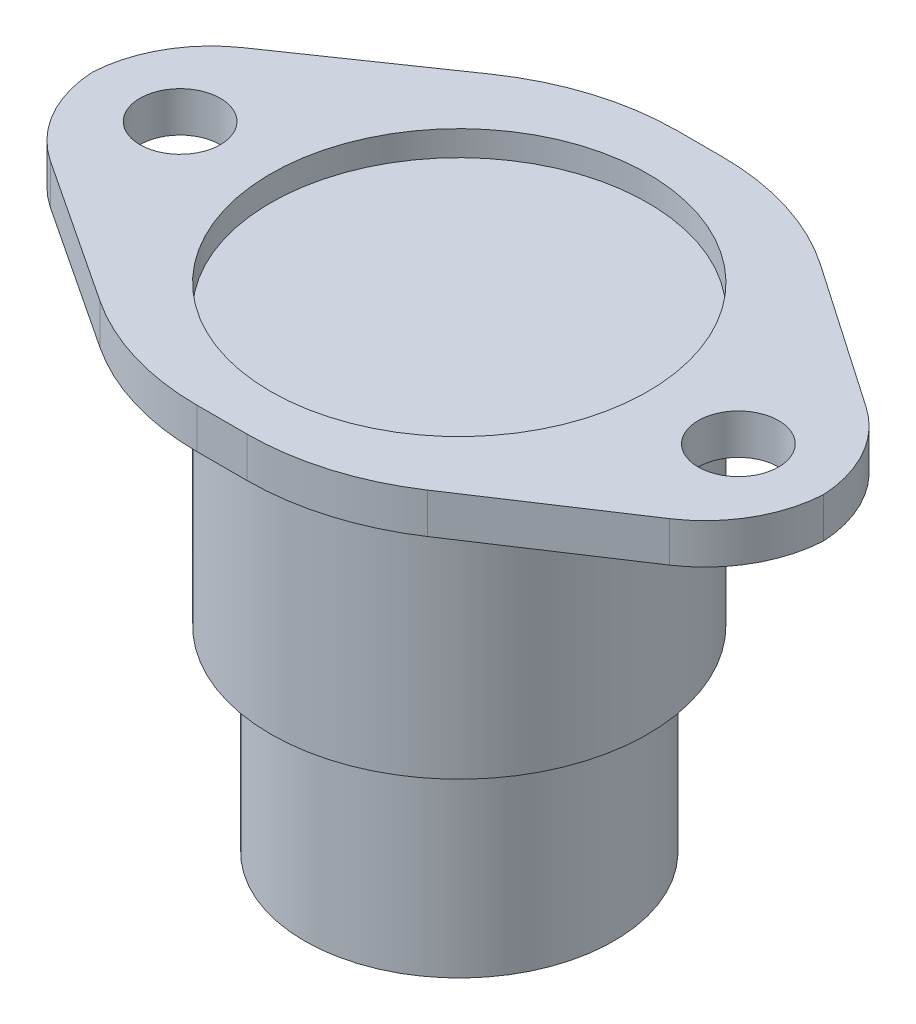
from build123d import *

# Parameters (mm, degrees)
SKETCH1_R           = 7.5
BOSS_EXTRUDE1_DEPTH = 10.2
SKETCH2_R           = 1.6
BOSS_EXTRUDE2_DEPTH = 1.6
SKETCH3_R           = 6.15
BOSS_EXTRUDE3_DEPTH = 7.8
CUT_EXTRUDE1_START  = -1
SKETCH4_R           = 7.5
CUT_EXTRUDE1_DEPTH  = 1
FILLET1_R           = 5
FILLET2_R           = 10


with BuildPart() as part:
    # Sketch1 → Boss-Extrude1 (new body)
    with BuildSketch(Plane(origin=(0, 0, 0), x_dir=(1, 0, 0), z_dir=(0, 1, 0))):
        with Locations(Location((0, 0, 0), (0, 0, 270))):
            Circle(SKETCH1_R)
    extrude(amount=BOSS_EXTRUDE1_DEPTH)

    # Sketch2 → Boss-Extrude2 (add)
    with BuildSketch(Plane(origin=(0, 10.2, 0), x_dir=(1, 0, 0), z_dir=(0, 1, 0))):
        Polygon((-14.55, 2.306992561), (-14.55, -2.466095496), (-4, -9.43480406), (4, -9.43480406), (14.55, -2.466095496), (14.55, 2.306992561), (4, 9.56519594), (-4, 9.56519594), align=None)
        with Locations(Location((-11.1, 0, 0), (0, 0, 270))):
            Circle(SKETCH2_R, mode=Mode.SUBTRACT)
        with Locations(Location((11.1, 0, 0), (0, 0, 270))):
            Circle(SKETCH2_R, mode=Mode.SUBTRACT)
    extrude(amount=BOSS_EXTRUDE2_DEPTH)

    # Sketch3 → Boss-Extrude3 (add)
    with BuildSketch(Plane.XZ):
        with Locations(Location((0, 0, 0), (0, 0, 90))):
            Circle(SKETCH3_R)
    extrude(amount=BOSS_EXTRUDE3_DEPTH)

    # Sketch4 → Cut-Extrude1 (cut)
    with BuildSketch(Plane(origin=(0, 11.8, 0), x_dir=(1, 0, 0), z_dir=(0, 1, 0)).offset(CUT_EXTRUDE1_START)):
        with Locations(Location((0, 0, 0), (0, 0, 270))):
            Circle(SKETCH4_R)
    extrude(amount=CUT_EXTRUDE1_DEPTH, mode=Mode.SUBTRACT)

    # Fillet1
    # the kernel refuses this fillet: 5 mm, written as the material it takes off along each edge
    with BuildSketch(Plane(origin=(14.55, 3.627226277, -2.306992561), x_dir=(-0.8238567421682754, 0, -0.5667980843156368), z_dir=(0, 1, 0)), Plane(origin=(-14.55, 3.627226277, -2.306992561), x_dir=(0, 0, 1), z_dir=(0, 1, 0))) as fillet1_piece_1:
        with BuildLine():
            CenterArc((FILLET1_R * 0.525821897803, FILLET1_R), FILLET1_R, 214.527246886, 55.472753114)
            Line((-FILLET1_R * 0.298034844366, FILLET1_R * 0.433201915684), (0, 0))
            Line((0, 0), (FILLET1_R * 0.525821897803, 0))
        make_face()
    extrude(amount=14.745547445, mode=Mode.SUBTRACT)
    with BuildSketch(Plane(origin=(14.55, 3.475971105, 2.466095496), x_dir=(-0.8344017794446341, 0, 0.5511566659849338), z_dir=(0, 1, 0)), Plane(origin=(-14.55, 3.475971105, 2.466095496), x_dir=(0, 0, -1), z_dir=(0, 1, 0))) as fillet1_piece_2:
        with BuildLine():
            CenterArc((FILLET1_R * 0.537922311616, -FILLET1_R), FILLET1_R, 90, 56.553598673)
            Line((-FILLET1_R * 0.296479467829, -FILLET1_R * 0.448843334015), (0, 0))
            Line((0, 0), (FILLET1_R * 0.537922311616, 0))
        make_face()
    extrude(amount=15.04805779, mode=Mode.SUBTRACT)

    # Fillet2
    fillet2_edges = [part.edges().sort_by_distance(p)[0] for p in [
        (-4, 11, 9.43480406),
        (4, 11, 9.43480406),
        (4, 11, -9.56519594),
        (-4, 11, -9.56519594),
    ]]
    fillet(fillet2_edges, radius=FILLET2_R)


solid = part.part
